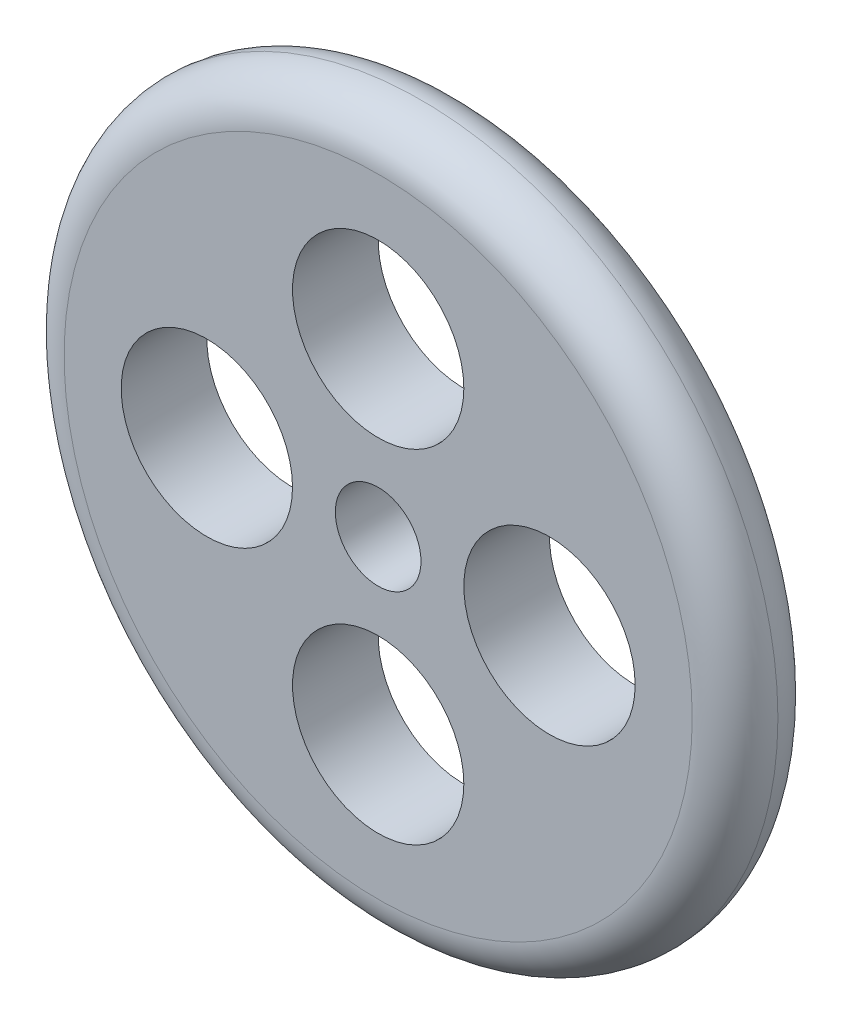
from build123d import *

# Parameters (mm, degrees)
SKETCH2_R           = 125
BOSS_EXTRUDE1_DEPTH = 30
FILLET1_R           = 15
SKETCH3_R           = 15
CUT_EXTRUDE1_DEPTH  = 180.30421077
SKETCH6_R           = 30
CUT_EXTRUDE2_DEPTH  = 180.30421077


with BuildPart() as part:
    # Sketch2 → Boss-Extrude1 (new body)
    with BuildSketch(Plane.XY):
        Circle(SKETCH2_R)
    extrude(amount=BOSS_EXTRUDE1_DEPTH)

    # Fillet1
    fillet1_edges = [part.edges().sort_by_distance(p)[0] for p in [
        (-125, 0, 0),
        (-125, 0, 30),
    ]]
    fillet(fillet1_edges, radius=FILLET1_R - 0.0001)  # a hair under: the kernel refuses the full size

    # Sketch3 → Cut-Extrude1 (cut, through all)
    with BuildSketch(Plane.XY.offset(30)):
        Circle(SKETCH3_R)
    extrude(amount=-CUT_EXTRUDE1_DEPTH, mode=Mode.SUBTRACT)

    # Sketch6 → Cut-Extrude2 (cut, through all)
    with BuildSketch(Plane.XY.offset(30)):
        with Locations((0, 60)):
            Circle(SKETCH6_R)
        with Locations((60, 0)):
            Circle(SKETCH6_R)
        with Locations((0, -60)):
            Circle(SKETCH6_R)
        with Locations((-60, 0)):
            Circle(SKETCH6_R)
    extrude(amount=-CUT_EXTRUDE2_DEPTH, mode=Mode.SUBTRACT)


solid = part.part
